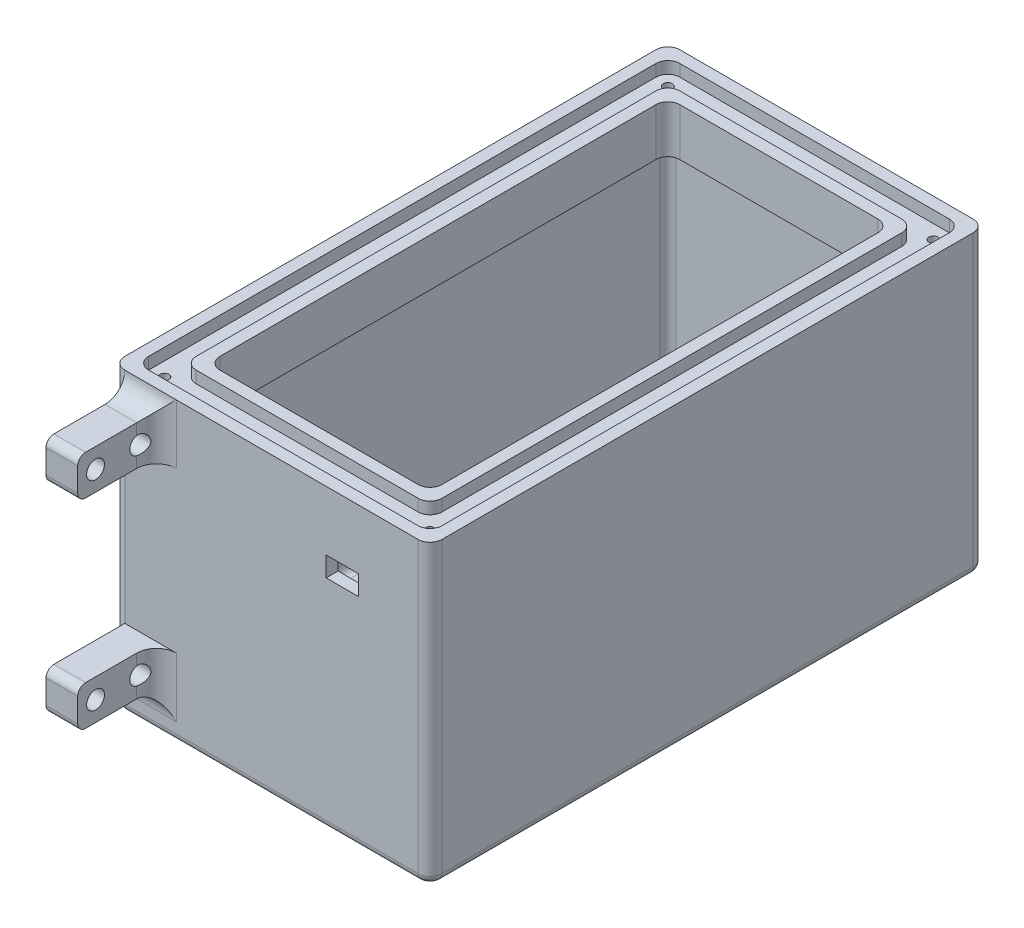
from build123d import *

# Parameters (mm, degrees)
SKETCH1_W           = 80
SKETCH1_H           = 140
BOSS_EXTRUDE1_DEPTH = 3
SKETCH2_W           = 80
SKETCH2_H           = 140
SKETCH2_W_2         = 74
SKETCH2_H_2         = 134
BOSS_EXTRUDE2_DEPTH = 60
FILLET1_R           = 2
FILLET2_R           = 2
SKETCH6_W           = 80
SKETCH6_H           = 140
BOSS_EXTRUDE3_DEPTH = 12
CUT_EXTRUDE1_DEPTH  = 3
SKETCH8_R           = 1.15
CUT_EXTRUDE2_DEPTH  = 6
FILLET3_R           = 3
SKETCH9_W           = 5
SKETCH9_H           = 26
BOSS_EXTRUDE4_DEPTH = 15
SKETCH10_W          = 5
SKETCH10_H          = 26
BOSS_EXTRUDE5_DEPTH = 53
FILLET4_R           = 3
FILLET5_R           = 3
SKETCH12_W          = 8
SKETCH12_H          = 10
BOSS_EXTRUDE6_DEPTH = 19.88
FILLET6_R           = 5
FILLET7_R           = 2
SKETCH13_R          = 2.25
CUT_EXTRUDE3_DEPTH  = 177.504957437
SKETCH14_W          = 8.2
SKETCH14_H          = 5
CUT_EXTRUDE4_DEPTH  = 3
BOSS_EXTRUDE7_DEPTH = 1.35
SKETCH16_W          = 5
SKETCH16_H          = 2.7
CUT_EXTRUDE5_DEPTH  = 3


with BuildPart() as part:
    # Sketch1 → Boss-Extrude1 (new body)
    with BuildSketch(Plane(origin=(0, 0, 0), x_dir=(1, 0, 0), z_dir=(0, 1, 0))):
        with Locations((40, 70)):
            Rectangle(SKETCH1_W, SKETCH1_H)
    extrude(amount=BOSS_EXTRUDE1_DEPTH)

    # Sketch2 → Boss-Extrude2 (add)
    with BuildSketch(Plane(origin=(0, 3, 0), x_dir=(1, 0, 0), z_dir=(0, 1, 0))):
        with Locations((40, 70)):
            Rectangle(SKETCH2_W, SKETCH2_H)
        with Locations((40, 70)):
            Rectangle(SKETCH2_W_2, SKETCH2_H_2, mode=Mode.SUBTRACT)
    extrude(amount=BOSS_EXTRUDE2_DEPTH)

    # Fillet1
    fillet1_edges = [part.edges().sort_by_distance(p)[0] for p in [
        (3, 3, -70),
        (40, 3, -3),
        (77, 3, -70),
        (40, 3, -137),
        (3, 33, -3),
        (77, 33, -3),
        (77, 33, -137),
        (3, 33, -137),
    ]]
    fillet(fillet1_edges, radius=FILLET1_R)

    # Fillet2
    fillet2_edges = [part.edges().sort_by_distance(p)[0] for p in [
        (40, 0, -140),
        (80, 0, -70),
        (40, 0, 0),
        (0, 0, -70),
    ]]
    fillet(fillet2_edges, radius=FILLET2_R)

    # Sketch6 → Boss-Extrude3 (add)
    with BuildSketch(Plane(origin=(0, 63, 0), x_dir=(1, 0, 0), z_dir=(0, 1, 0))):
        with Locations((40, 70)):
            Rectangle(SKETCH6_W, SKETCH6_H)
        with BuildLine():
            Line((15, 128), (65, 128))
            ThreePointArc((65, 128), (67.121320344, 127.121320344), (68, 125))
            Line((68, 125), (68, 15))
            ThreePointArc((68, 15), (67.121320344, 12.878679656), (65, 12))
            Line((65, 12), (15, 12))
            ThreePointArc((15, 12), (12.878679656, 12.878679656), (12, 15))
            Line((12, 15), (12, 125))
            ThreePointArc((12, 125), (12.878679656, 127.121320344), (15, 128))
        make_face(mode=Mode.SUBTRACT)
    extrude(amount=BOSS_EXTRUDE3_DEPTH)

    # Sketch7 → Cut-Extrude1 (cut)
    with BuildSketch(Plane(origin=(0, 75, 0), x_dir=(1, 0, 0), z_dir=(0, 1, 0))):
        with BuildLine():
            Line((6, 137), (74, 137))
            ThreePointArc((74, 137), (76.121320344, 136.121320344), (77, 134))
            Line((77, 134), (77, 6))
            ThreePointArc((77, 6), (76.121320344, 3.878679656), (74, 3))
            Line((74, 3), (6, 3))
            ThreePointArc((6, 3), (3.878679656, 3.878679656), (3, 6))
            Line((3, 6), (3, 134))
            ThreePointArc((3, 134), (3.878679656, 136.121320344), (6, 137))
        make_face()
        with BuildLine():
            Line((12, 131), (68, 131))
            ThreePointArc((68, 131), (70.121320344, 130.121320344), (71, 128))
            Line((71, 128), (71, 12))
            ThreePointArc((71, 12), (70.121320344, 9.878679656), (68, 9))
            Line((68, 9), (12, 9))
            ThreePointArc((12, 9), (9.878679656, 9.878679656), (9, 12))
            Line((9, 12), (9, 128))
            ThreePointArc((9, 128), (9.878679656, 130.121320344), (12, 131))
        make_face(mode=Mode.SUBTRACT)
    extrude(amount=-CUT_EXTRUDE1_DEPTH, mode=Mode.SUBTRACT)

    # Sketch8 → Cut-Extrude2 (cut)
    with BuildSketch(Plane(origin=(0, 72, 0), x_dir=(1, 0, 0), z_dir=(0, 1, 0))):
        with Locations(Location((6.5, 6.5, 0), (0, 0, 270))):
            Circle(SKETCH8_R)
        with Locations(Location((73.5, 6.5, 0), (0, 0, 270))):
            Circle(SKETCH8_R)
        with Locations(Location((73.5, 133.5, 0), (0, 0, 270))):
            Circle(SKETCH8_R)
        with Locations(Location((6.5, 133.5, 0), (0, 0, 270))):
            Circle(SKETCH8_R)
    extrude(amount=-CUT_EXTRUDE2_DEPTH, mode=Mode.SUBTRACT)

    # Fillet3
    # the kernel refuses this fillet: 3 mm, written as the material it takes off along each edge
    with BuildSketch(Plane(origin=(77, 0, -3), x_dir=(1, 0, 0), z_dir=(0, 0, -1))) as fillet3_piece_1:
        with BuildLine():
            CenterArc((1, -2), 2, 0, 90)
            Line((3, -2), (3, 0))
            Line((3, 0), (1, 0))
        make_face()
    revolve(axis=Axis((77, 0, -3), (0, -1, 0)), revolution_arc=90, mode=Mode.SUBTRACT)
    with BuildSketch(Plane(origin=(3, 0, -3), x_dir=(0, 0, 1), z_dir=(1, 0, 0))) as fillet3_piece_2:
        with BuildLine():
            CenterArc((1, -2), 2, 0, 90)
            Line((3, -2), (3, 0))
            Line((3, 0), (1, 0))
        make_face()
    revolve(axis=Axis((3, 0, -3), (0, -1, 0)), revolution_arc=90, mode=Mode.SUBTRACT)
    with BuildSketch(Plane(origin=(77, 0, -137), x_dir=(0, 0, -1), z_dir=(-1, 0, 0))) as fillet3_piece_3:
        with BuildLine():
            CenterArc((1, -2), 2, 0, 90)
            Line((3, -2), (3, 0))
            Line((3, 0), (1, 0))
        make_face()
    revolve(axis=Axis((77, 0, -137), (0, -1, 0)), revolution_arc=90, mode=Mode.SUBTRACT)
    with BuildSketch(Plane(origin=(3, 0, -137), x_dir=(-1, 0, 0), z_dir=(0, 0, 1))) as fillet3_piece_4:
        with BuildLine():
            CenterArc((1, -2), 2, 0, 90)
            Line((3, -2), (3, 0))
            Line((3, 0), (1, 0))
        make_face()
    revolve(axis=Axis((3, 0, -137), (0, -1, 0)), revolution_arc=90, mode=Mode.SUBTRACT)
    with BuildSketch(Plane(origin=(0, 0, -140), x_dir=(1, 0, 0), z_dir=(0, 1, 0)), Plane(origin=(80, 82.5, -140), x_dir=(-1, 0, 0), z_dir=(0, -1, 0)), Plane(origin=(80, 82.5, 0), x_dir=(0, 0, -1), z_dir=(0, -1, 0)), Plane(origin=(0, 0, 0), x_dir=(0, 0, -1), z_dir=(0, 1, 0))) as fillet3_piece_5:
        with BuildLine():
            CenterArc((FILLET3_R, -FILLET3_R), FILLET3_R, 90, 90)
            Line((0, -FILLET3_R), (0, 0))
            Line((0, 0), (FILLET3_R, 0))
        make_face()
    extrude(amount=82.5, mode=Mode.SUBTRACT)

    # Sketch9 → Boss-Extrude4 (add)
    with BuildSketch(Plane.ZY):
        with Locations((-84.5, 42)):
            Rectangle(SKETCH9_W, SKETCH9_H)
    extrude(amount=BOSS_EXTRUDE4_DEPTH)

    # Sketch10 → Boss-Extrude5 (add)
    with BuildSketch(Plane(origin=(0, 0, -87), x_dir=(-1, 0, 0), z_dir=(0, 0, -1))):
        with Locations((12.5, 42)):
            Rectangle(SKETCH10_W, SKETCH10_H)
    extrude(amount=BOSS_EXTRUDE5_DEPTH)

    # Fillet4
    fillet4_edges = [part.edges().sort_by_distance(p)[0] for p in [
        (0, 42, -87),
        (0, 29, -84.5),
        (0, 42, -82),
        (0, 55, -84.5),
    ]]
    fillet(fillet4_edges, radius=FILLET4_R)

    # Fillet5
    fillet5_edges = [part.edges().sort_by_distance(p)[0] for p in [
        (-15, 42, -82),
        (-10, 42, -87),
        (-12.5, 55, -140),
        (-12.5, 29, -140),
    ]]
    fillet(fillet5_edges, radius=FILLET5_R)

    # Sketch12 → Boss-Extrude6 (add)
    with BuildSketch(Plane.XY):
        with Locations((7, 65)):
            Rectangle(SKETCH12_W, SKETCH12_H)
        with Locations((7, 14.67)):
            Rectangle(SKETCH12_W, SKETCH12_H)
    extrude(amount=BOSS_EXTRUDE6_DEPTH)

    # Fillet6
    # the kernel refuses this fillet: 5 mm, written as the material it adds along each edge
    with BuildSketch(Plane(origin=(11, 70, 0), x_dir=(1, 0, 0), z_dir=(0, -1, 0)), Plane(origin=(11, 19.67, 0), x_dir=(1, 0, 0), z_dir=(0, -1, 0))) as fillet6_piece_1:
        with BuildLine():
            CenterArc((FILLET6_R, FILLET6_R), FILLET6_R, 180, 90)
            Line((0, FILLET6_R), (0, 0))
            Line((0, 0), (FILLET6_R, 0))
        make_face()
    extrude(amount=10)
    with BuildSketch(Plane(origin=(3, 70, 0), x_dir=(0, 1, 0), z_dir=(1, 0, 0)), Plane(origin=(11, 9.67, 0), x_dir=(0, -1, 0), z_dir=(-1, 0, 0))) as fillet6_piece_2:
        with BuildLine():
            CenterArc((FILLET6_R, FILLET6_R), FILLET6_R, 180, 90)
            Line((0, FILLET6_R), (0, 0))
            Line((0, 0), (FILLET6_R, 0))
        make_face()
    extrude(amount=8)
    with BuildSketch(Plane(origin=(3, 70, 0), x_dir=(0, 1, 0), z_dir=(1, 0, 0))) as fillet6_piece_3a_section:
        with BuildLine():
            CenterArc((FILLET6_R, FILLET6_R), FILLET6_R, 180, 90)
            Line((0, FILLET6_R), (0, 0))
            Line((0, 0), (FILLET6_R, 0))
        make_face()
    fillet6_piece_3a = extrude(amount=20.5, mode=Mode.PRIVATE)
    fillet6_piece_3a = split(fillet6_piece_3a, bisect_by=Plane(origin=(11, 71.131975571, 1.131975571), z_dir=(1, 0, 0)), keep=Keep.TOP, mode=Mode.PRIVATE)
    with BuildSketch(Plane(origin=(11, 82.5, 0), x_dir=(1, 0, 0), z_dir=(0, -1, 0))) as fillet6_piece_3b_section:
        with BuildLine():
            CenterArc((FILLET6_R, FILLET6_R), FILLET6_R, 180, 90)
            Line((0, FILLET6_R), (0, 0))
            Line((0, 0), (FILLET6_R, 0))
        make_face()
    fillet6_piece_3b = extrude(amount=22.5, mode=Mode.PRIVATE)
    fillet6_piece_3b = split(fillet6_piece_3b, bisect_by=Plane(origin=(12.131975571, 75, 1.131975571), z_dir=(0, -1, 0)), keep=Keep.TOP, mode=Mode.PRIVATE)
    fillet6_piece_3b = split(fillet6_piece_3b, bisect_by=Plane(origin=(12.131975571, 70, 1.131975571), z_dir=(0, 1, 0)), keep=Keep.TOP, mode=Mode.PRIVATE)
    fillet6_piece_3 = fillet6_piece_3a & fillet6_piece_3b
    add(fillet6_piece_3)
    with BuildSketch(Plane(origin=(11, 19.67, 0), x_dir=(1, 0, 0), z_dir=(0, -1, 0))) as fillet6_piece_4a_section:
        with BuildLine():
            CenterArc((FILLET6_R, FILLET6_R), FILLET6_R, 180, 90)
            Line((0, FILLET6_R), (0, 0))
            Line((0, 0), (FILLET6_R, 0))
        make_face()
    fillet6_piece_4a = extrude(amount=22.5, mode=Mode.PRIVATE)
    fillet6_piece_4a = split(fillet6_piece_4a, bisect_by=Plane(origin=(12.131975571, 9.67, 1.131975571), z_dir=(0, -1, 0)), keep=Keep.TOP, mode=Mode.PRIVATE)
    with BuildSketch(Plane(origin=(23.5, 9.67, 0), x_dir=(0, -1, 0), z_dir=(-1, 0, 0))) as fillet6_piece_4b_section:
        with BuildLine():
            CenterArc((FILLET6_R, FILLET6_R), FILLET6_R, 180, 90)
            Line((0, FILLET6_R), (0, 0))
            Line((0, 0), (FILLET6_R, 0))
        make_face()
    fillet6_piece_4b = extrude(amount=20.5, mode=Mode.PRIVATE)
    fillet6_piece_4b = split(fillet6_piece_4b, bisect_by=Plane(origin=(11, 8.538024429, 1.131975571), z_dir=(1, 0, 0)), keep=Keep.TOP, mode=Mode.PRIVATE)
    fillet6_piece_4 = fillet6_piece_4a & fillet6_piece_4b
    add(fillet6_piece_4)

    # Fillet7
    fillet7_edges = [part.edges().sort_by_distance(p)[0] for p in [
        (7, 60, 19.88),
        (7, 70, 19.88),
        (7, 9.67, 19.88),
        (7, 19.67, 19.88),
    ]]
    fillet(fillet7_edges, radius=FILLET7_R)

    # Sketch13 → Cut-Extrude3 (cut, through all)
    with BuildSketch(Plane.ZY.offset(-3)):
        with Locations(Location((4.5, 65, 0), (0, 0, 270))):
            Circle(SKETCH13_R)
        with Locations(Location((15.38, 65, 0), (0, 0, 270))):
            Circle(SKETCH13_R)
        with Locations(Location((4.5, 14.67, 0), (0, 0, 270))):
            Circle(SKETCH13_R)
        with Locations(Location((15.38, 14.67, 0), (0, 0, 270))):
            Circle(SKETCH13_R)
    extrude(amount=-CUT_EXTRUDE3_DEPTH, mode=Mode.SUBTRACT)

    # Sketch14 → Cut-Extrude4 (cut)
    with BuildSketch(Plane.XY):
        with Locations((57.9, 57.5)):
            Rectangle(SKETCH14_W, SKETCH14_H)
    extrude(amount=-CUT_EXTRUDE4_DEPTH, mode=Mode.SUBTRACT)

    # Sketch15 → Boss-Extrude7 (add)
    with BuildSketch(Plane.XZ):
        with BuildLine():
            Line((19.25, -42.75), (60.75, -42.75))
            ThreePointArc((60.75, -42.75), (61.810660172, -43.189339828), (62.25, -44.25))
            Line((62.25, -44.25), (62.25, -95.75))
            ThreePointArc((62.25, -95.75), (61.810660172, -96.810660172), (60.75, -97.25))
            Line((60.75, -97.25), (19.25, -97.25))
            ThreePointArc((19.25, -97.25), (18.189339828, -96.810660172), (17.75, -95.75))
            Line((17.75, -95.75), (17.75, -44.25))
            ThreePointArc((17.75, -44.25), (18.189339828, -43.189339828), (19.25, -42.75))
        make_face()
        with BuildLine():
            Line((21.25, -44.75), (58.75, -44.75))
            ThreePointArc((58.75, -44.75), (59.810660172, -45.189339828), (60.25, -46.25))
            Line((60.25, -46.25), (60.25, -93.75))
            ThreePointArc((60.25, -93.75), (59.810660172, -94.810660172), (58.75, -95.25))
            Line((58.75, -95.25), (21.25, -95.25))
            ThreePointArc((21.25, -95.25), (20.189339828, -94.810660172), (19.75, -93.75))
            Line((19.75, -93.75), (19.75, -46.25))
            ThreePointArc((19.75, -46.25), (20.189339828, -45.189339828), (21.25, -44.75))
        make_face(mode=Mode.SUBTRACT)
    extrude(amount=BOSS_EXTRUDE7_DEPTH)

    # Sketch16 → Cut-Extrude5 (cut)
    with BuildSketch(Plane.XZ):
        with Locations((40, -48.03)):
            Rectangle(SKETCH16_W, SKETCH16_H)
    extrude(amount=-CUT_EXTRUDE5_DEPTH, mode=Mode.SUBTRACT)


solid = part.part
